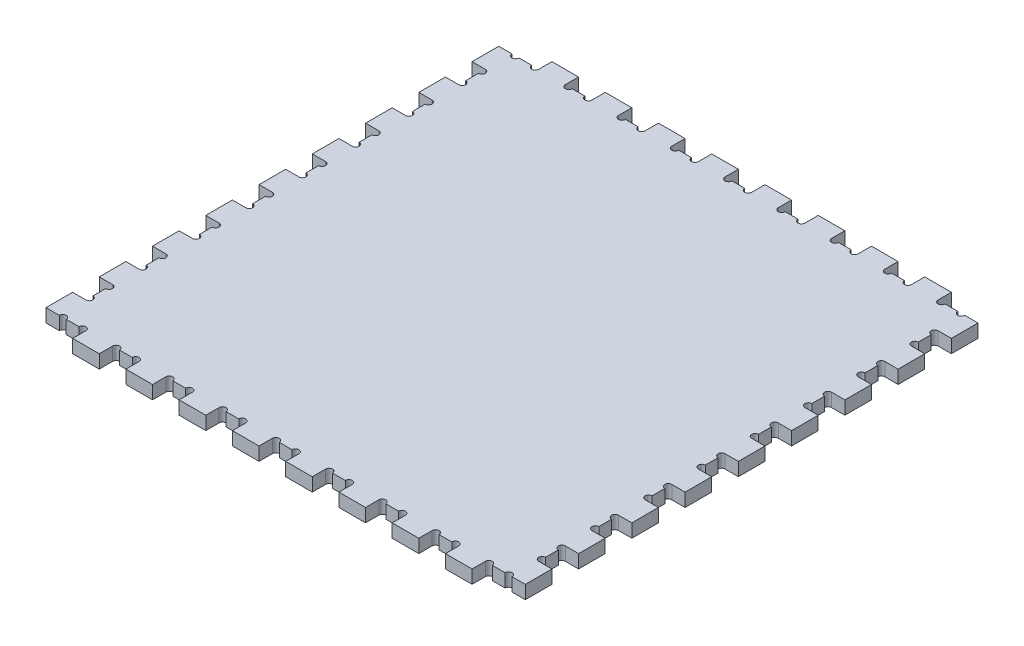
from build123d import *

# Parameters (mm, degrees)
SKETCH1_W               = 457.2
SKETCH1_H               = 457.2
BOSS_EXTRUDE1_DEPTH     = 12.7
CUT_EXTRUDE1_DEPTH      = 12.7
LPATTERN1_COUNT         = 9
LPATTERN1_PITCH         = 50.8
MIRROR1_COPY_1_DEPTH    = 12.7
MIRROR1_COPY_2_DEPTH    = 12.7
MIRROR1_COPY_3_DEPTH    = 12.7
MIRROR1_COPY_4_DEPTH    = 12.7
MIRROR1_COPY_5_DEPTH    = 12.7
MIRROR1_COPY_6_DEPTH    = 12.7
MIRROR1_COPY_7_DEPTH    = 12.7
MIRROR1_COPY_8_DEPTH    = 12.7
MIRROR1_COPY_9_DEPTH    = 12.7
SKETCH3_W               = 12.7
SKETCH3_H               = 12.7
CUT_EXTRUDE2_DEPTH      = 324.538575753
MIRROR3_COPY_1_SKETCH_W = 12.7
MIRROR3_COPY_1_SKETCH_H = 12.7
MIRROR3_COPY_1_DEPTH    = 324.538575753
MIRROR3_COPY_2_SKETCH_W = 12.7
MIRROR3_COPY_2_SKETCH_H = 12.7
MIRROR3_COPY_2_DEPTH    = 324.538575753
CUT_EXTRUDE3_DEPTH      = 324.538575753
LPATTERN2_COUNT         = 9
LPATTERN2_PITCH         = 50.8
MIRROR4_COPY_1_DEPTH    = 324.538575753
MIRROR4_COPY_2_DEPTH    = 324.538575753
MIRROR4_COPY_3_DEPTH    = 324.538575753
MIRROR4_COPY_4_DEPTH    = 324.538575753
MIRROR4_COPY_5_DEPTH    = 324.538575753
MIRROR4_COPY_6_DEPTH    = 324.538575753
MIRROR4_COPY_7_DEPTH    = 324.538575753
MIRROR4_COPY_8_DEPTH    = 324.538575753
MIRROR4_COPY_9_DEPTH    = 324.538575753


with BuildPart() as part:
    # Sketch1 → Boss-Extrude1 (new body)
    with BuildSketch(Plane(origin=(0, 0, 0), x_dir=(1, 0, 0), z_dir=(0, 1, 0))):
        Rectangle(SKETCH1_W, SKETCH1_H)
    extrude(amount=BOSS_EXTRUDE1_DEPTH)

    # Sketch2 → Cut-Extrude1 (cut)
    with BuildSketch(Plane(origin=(0, 12.7, 0), x_dir=(1, 0, 0), z_dir=(0, 1, 0))):
        with BuildLine():
            Line((-190.5, 228.6), (-215.9, 228.6))
            Line((-215.9, 228.6), (-215.9, 215.9))
            ThreePointArc((-215.9, 215.9), (-212.598, 212.598), (-209.296, 215.9))
            Line((-209.296, 215.9), (-197.104, 215.9))
            ThreePointArc((-197.104, 215.9), (-193.802, 212.598), (-190.5, 215.9))
            Line((-190.5, 215.9), (-190.5, 228.6))
        make_face()
    cut_extrude1 = extrude(amount=-CUT_EXTRUDE1_DEPTH, mode=Mode.SUBTRACT)

    # LPattern1: Cut-Extrude1 ×9
    with Locations(*[(i * LPATTERN1_PITCH, 0, 0) for i in range(1, LPATTERN1_COUNT)]):
        add(cut_extrude1, mode=Mode.SUBTRACT)

    # Mirror1 copy 1 sketch → Mirror1 copy 1 (cut)
    with BuildSketch(Plane(origin=(50.8, 12.7, 0), x_dir=(1, 0, 0), z_dir=(0, 1, 0))):
        with BuildLine():
            Line((-190.5, -228.6), (-215.9, -228.6))
            Line((-215.9, -228.6), (-215.9, -215.9))
            ThreePointArc((-215.9, -215.9), (-212.598, -212.598), (-209.296, -215.9))
            Line((-209.296, -215.9), (-197.104, -215.9))
            ThreePointArc((-197.104, -215.9), (-193.802, -212.598), (-190.5, -215.9))
            Line((-190.5, -215.9), (-190.5, -228.6))
        make_face()
    extrude(amount=-MIRROR1_COPY_1_DEPTH, mode=Mode.SUBTRACT)

    # Mirror1 copy 2 sketch → Mirror1 copy 2 (cut)
    with BuildSketch(Plane(origin=(101.6, 12.7, 0), x_dir=(1, 0, 0), z_dir=(0, 1, 0))):
        with BuildLine():
            Line((-190.5, -228.6), (-215.9, -228.6))
            Line((-215.9, -228.6), (-215.9, -215.9))
            ThreePointArc((-215.9, -215.9), (-212.598, -212.598), (-209.296, -215.9))
            Line((-209.296, -215.9), (-197.104, -215.9))
            ThreePointArc((-197.104, -215.9), (-193.802, -212.598), (-190.5, -215.9))
            Line((-190.5, -215.9), (-190.5, -228.6))
        make_face()
    extrude(amount=-MIRROR1_COPY_2_DEPTH, mode=Mode.SUBTRACT)

    # Mirror1 copy 3 sketch → Mirror1 copy 3 (cut)
    with BuildSketch(Plane(origin=(152.4, 12.7, 0), x_dir=(1, 0, 0), z_dir=(0, 1, 0))):
        with BuildLine():
            Line((-190.5, -228.6), (-215.9, -228.6))
            Line((-215.9, -228.6), (-215.9, -215.9))
            ThreePointArc((-215.9, -215.9), (-212.598, -212.598), (-209.296, -215.9))
            Line((-209.296, -215.9), (-197.104, -215.9))
            ThreePointArc((-197.104, -215.9), (-193.802, -212.598), (-190.5, -215.9))
            Line((-190.5, -215.9), (-190.5, -228.6))
        make_face()
    extrude(amount=-MIRROR1_COPY_3_DEPTH, mode=Mode.SUBTRACT)

    # Mirror1 copy 4 sketch → Mirror1 copy 4 (cut)
    with BuildSketch(Plane(origin=(203.2, 12.7, 0), x_dir=(1, 0, 0), z_dir=(0, 1, 0))):
        with BuildLine():
            Line((-190.5, -228.6), (-215.9, -228.6))
            Line((-215.9, -228.6), (-215.9, -215.9))
            ThreePointArc((-215.9, -215.9), (-212.598, -212.598), (-209.296, -215.9))
            Line((-209.296, -215.9), (-197.104, -215.9))
            ThreePointArc((-197.104, -215.9), (-193.802, -212.598), (-190.5, -215.9))
            Line((-190.5, -215.9), (-190.5, -228.6))
        make_face()
    extrude(amount=-MIRROR1_COPY_4_DEPTH, mode=Mode.SUBTRACT)

    # Mirror1 copy 5 sketch → Mirror1 copy 5 (cut)
    with BuildSketch(Plane(origin=(254, 12.7, 0), x_dir=(1, 0, 0), z_dir=(0, 1, 0))):
        with BuildLine():
            Line((-190.5, -228.6), (-215.9, -228.6))
            Line((-215.9, -228.6), (-215.9, -215.9))
            ThreePointArc((-215.9, -215.9), (-212.598, -212.598), (-209.296, -215.9))
            Line((-209.296, -215.9), (-197.104, -215.9))
            ThreePointArc((-197.104, -215.9), (-193.802, -212.598), (-190.5, -215.9))
            Line((-190.5, -215.9), (-190.5, -228.6))
        make_face()
    extrude(amount=-MIRROR1_COPY_5_DEPTH, mode=Mode.SUBTRACT)

    # Mirror1 copy 6 sketch → Mirror1 copy 6 (cut)
    with BuildSketch(Plane(origin=(304.8, 12.7, 0), x_dir=(1, 0, 0), z_dir=(0, 1, 0))):
        with BuildLine():
            Line((-190.5, -228.6), (-215.9, -228.6))
            Line((-215.9, -228.6), (-215.9, -215.9))
            ThreePointArc((-215.9, -215.9), (-212.598, -212.598), (-209.296, -215.9))
            Line((-209.296, -215.9), (-197.104, -215.9))
            ThreePointArc((-197.104, -215.9), (-193.802, -212.598), (-190.5, -215.9))
            Line((-190.5, -215.9), (-190.5, -228.6))
        make_face()
    extrude(amount=-MIRROR1_COPY_6_DEPTH, mode=Mode.SUBTRACT)

    # Mirror1 copy 7 sketch → Mirror1 copy 7 (cut)
    with BuildSketch(Plane(origin=(355.6, 12.7, 0), x_dir=(1, 0, 0), z_dir=(0, 1, 0))):
        with BuildLine():
            Line((-190.5, -228.6), (-215.9, -228.6))
            Line((-215.9, -228.6), (-215.9, -215.9))
            ThreePointArc((-215.9, -215.9), (-212.598, -212.598), (-209.296, -215.9))
            Line((-209.296, -215.9), (-197.104, -215.9))
            ThreePointArc((-197.104, -215.9), (-193.802, -212.598), (-190.5, -215.9))
            Line((-190.5, -215.9), (-190.5, -228.6))
        make_face()
    extrude(amount=-MIRROR1_COPY_7_DEPTH, mode=Mode.SUBTRACT)

    # Mirror1 copy 8 sketch → Mirror1 copy 8 (cut)
    with BuildSketch(Plane(origin=(406.4, 12.7, 0), x_dir=(1, 0, 0), z_dir=(0, 1, 0))):
        with BuildLine():
            Line((-190.5, -228.6), (-215.9, -228.6))
            Line((-215.9, -228.6), (-215.9, -215.9))
            ThreePointArc((-215.9, -215.9), (-212.598, -212.598), (-209.296, -215.9))
            Line((-209.296, -215.9), (-197.104, -215.9))
            ThreePointArc((-197.104, -215.9), (-193.802, -212.598), (-190.5, -215.9))
            Line((-190.5, -215.9), (-190.5, -228.6))
        make_face()
    extrude(amount=-MIRROR1_COPY_8_DEPTH, mode=Mode.SUBTRACT)

    # Mirror1 copy 9 sketch → Mirror1 copy 9 (cut)
    with BuildSketch(Plane(origin=(0, 12.7, 0), x_dir=(1, 0, 0), z_dir=(0, 1, 0))):
        with BuildLine():
            Line((-190.5, -228.6), (-215.9, -228.6))
            Line((-215.9, -228.6), (-215.9, -215.9))
            ThreePointArc((-215.9, -215.9), (-212.598, -212.598), (-209.296, -215.9))
            Line((-209.296, -215.9), (-197.104, -215.9))
            ThreePointArc((-197.104, -215.9), (-193.802, -212.598), (-190.5, -215.9))
            Line((-190.5, -215.9), (-190.5, -228.6))
        make_face()
    extrude(amount=-MIRROR1_COPY_9_DEPTH, mode=Mode.SUBTRACT)

    # Sketch3 → Cut-Extrude2 (cut, through all)
    with BuildSketch(Plane(origin=(0, 12.7, 0), x_dir=(1, 0, 0), z_dir=(0, 1, 0))):
        with Locations((-222.25, 222.25)):
            Rectangle(SKETCH3_W, SKETCH3_H)
    cut_extrude2 = extrude(amount=-CUT_EXTRUDE2_DEPTH, mode=Mode.SUBTRACT)

    # Mirror2: Cut-Extrude2 across plane
    add(cut_extrude2.mirror(Plane.ZY), mode=Mode.SUBTRACT)

    # Mirror3 copy 1 sketch → Mirror3 copy 1 (cut, through all)
    with BuildSketch(Plane(origin=(0, 12.7, 0), x_dir=(-1, 0, 0), z_dir=(0, 1, 0))):
        with Locations((-222.25, 222.25)):
            Rectangle(MIRROR3_COPY_1_SKETCH_W, MIRROR3_COPY_1_SKETCH_H)
    extrude(amount=-MIRROR3_COPY_1_DEPTH, mode=Mode.SUBTRACT)

    # Mirror3 copy 2 sketch → Mirror3 copy 2 (cut, through all)
    with BuildSketch(Plane(origin=(0, 12.7, 0), x_dir=(1, 0, 0), z_dir=(0, 1, 0))):
        with Locations((-222.25, -222.25)):
            Rectangle(MIRROR3_COPY_2_SKETCH_W, MIRROR3_COPY_2_SKETCH_H)
    extrude(amount=-MIRROR3_COPY_2_DEPTH, mode=Mode.SUBTRACT)

    # Sketch4 → Cut-Extrude3 (cut, through all)
    with BuildSketch(Plane(origin=(0, 12.7, 0), x_dir=(1, 0, 0), z_dir=(0, 1, 0))):
        with BuildLine():
            Line((-215.9, 190.5), (-228.6, 190.5))
            Line((-228.6, 190.5), (-228.6, 165.1))
            Line((-228.6, 165.1), (-215.9, 165.1))
            ThreePointArc((-215.9, 165.1), (-212.598, 168.402), (-215.9, 171.704))
            Line((-215.9, 171.704), (-215.9, 183.896))
            ThreePointArc((-215.9, 183.896), (-212.598, 187.198), (-215.9, 190.5))
        make_face()
    cut_extrude3 = extrude(amount=-CUT_EXTRUDE3_DEPTH, mode=Mode.SUBTRACT)

    # LPattern2: Cut-Extrude3 ×9
    with Locations(*[(0, 0, i * LPATTERN2_PITCH) for i in range(1, LPATTERN2_COUNT)]):
        add(cut_extrude3, mode=Mode.SUBTRACT)

    # Mirror4 copy 1 sketch → Mirror4 copy 1 (cut, through all)
    with BuildSketch(Plane(origin=(0, 12.7, 50.8), x_dir=(-1, 0, 0), z_dir=(0, 1, 0))):
        with BuildLine():
            Line((-215.9, -190.5), (-228.6, -190.5))
            Line((-228.6, -190.5), (-228.6, -165.1))
            Line((-228.6, -165.1), (-215.9, -165.1))
            ThreePointArc((-215.9, -165.1), (-212.598, -168.402), (-215.9, -171.704))
            Line((-215.9, -171.704), (-215.9, -183.896))
            ThreePointArc((-215.9, -183.896), (-212.598, -187.198), (-215.9, -190.5))
        make_face()
    extrude(amount=-MIRROR4_COPY_1_DEPTH, mode=Mode.SUBTRACT)

    # Mirror4 copy 2 sketch → Mirror4 copy 2 (cut, through all)
    with BuildSketch(Plane(origin=(0, 12.7, 101.6), x_dir=(-1, 0, 0), z_dir=(0, 1, 0))):
        with BuildLine():
            Line((-215.9, -190.5), (-228.6, -190.5))
            Line((-228.6, -190.5), (-228.6, -165.1))
            Line((-228.6, -165.1), (-215.9, -165.1))
            ThreePointArc((-215.9, -165.1), (-212.598, -168.402), (-215.9, -171.704))
            Line((-215.9, -171.704), (-215.9, -183.896))
            ThreePointArc((-215.9, -183.896), (-212.598, -187.198), (-215.9, -190.5))
        make_face()
    extrude(amount=-MIRROR4_COPY_2_DEPTH, mode=Mode.SUBTRACT)

    # Mirror4 copy 3 sketch → Mirror4 copy 3 (cut, through all)
    with BuildSketch(Plane(origin=(0, 12.7, 152.4), x_dir=(-1, 0, 0), z_dir=(0, 1, 0))):
        with BuildLine():
            Line((-215.9, -190.5), (-228.6, -190.5))
            Line((-228.6, -190.5), (-228.6, -165.1))
            Line((-228.6, -165.1), (-215.9, -165.1))
            ThreePointArc((-215.9, -165.1), (-212.598, -168.402), (-215.9, -171.704))
            Line((-215.9, -171.704), (-215.9, -183.896))
            ThreePointArc((-215.9, -183.896), (-212.598, -187.198), (-215.9, -190.5))
        make_face()
    extrude(amount=-MIRROR4_COPY_3_DEPTH, mode=Mode.SUBTRACT)

    # Mirror4 copy 4 sketch → Mirror4 copy 4 (cut, through all)
    with BuildSketch(Plane(origin=(0, 12.7, 203.2), x_dir=(-1, 0, 0), z_dir=(0, 1, 0))):
        with BuildLine():
            Line((-215.9, -190.5), (-228.6, -190.5))
            Line((-228.6, -190.5), (-228.6, -165.1))
            Line((-228.6, -165.1), (-215.9, -165.1))
            ThreePointArc((-215.9, -165.1), (-212.598, -168.402), (-215.9, -171.704))
            Line((-215.9, -171.704), (-215.9, -183.896))
            ThreePointArc((-215.9, -183.896), (-212.598, -187.198), (-215.9, -190.5))
        make_face()
    extrude(amount=-MIRROR4_COPY_4_DEPTH, mode=Mode.SUBTRACT)

    # Mirror4 copy 5 sketch → Mirror4 copy 5 (cut, through all)
    with BuildSketch(Plane(origin=(0, 12.7, 254), x_dir=(-1, 0, 0), z_dir=(0, 1, 0))):
        with BuildLine():
            Line((-215.9, -190.5), (-228.6, -190.5))
            Line((-228.6, -190.5), (-228.6, -165.1))
            Line((-228.6, -165.1), (-215.9, -165.1))
            ThreePointArc((-215.9, -165.1), (-212.598, -168.402), (-215.9, -171.704))
            Line((-215.9, -171.704), (-215.9, -183.896))
            ThreePointArc((-215.9, -183.896), (-212.598, -187.198), (-215.9, -190.5))
        make_face()
    extrude(amount=-MIRROR4_COPY_5_DEPTH, mode=Mode.SUBTRACT)

    # Mirror4 copy 6 sketch → Mirror4 copy 6 (cut, through all)
    with BuildSketch(Plane(origin=(0, 12.7, 304.8), x_dir=(-1, 0, 0), z_dir=(0, 1, 0))):
        with BuildLine():
            Line((-215.9, -190.5), (-228.6, -190.5))
            Line((-228.6, -190.5), (-228.6, -165.1))
            Line((-228.6, -165.1), (-215.9, -165.1))
            ThreePointArc((-215.9, -165.1), (-212.598, -168.402), (-215.9, -171.704))
            Line((-215.9, -171.704), (-215.9, -183.896))
            ThreePointArc((-215.9, -183.896), (-212.598, -187.198), (-215.9, -190.5))
        make_face()
    extrude(amount=-MIRROR4_COPY_6_DEPTH, mode=Mode.SUBTRACT)

    # Mirror4 copy 7 sketch → Mirror4 copy 7 (cut, through all)
    with BuildSketch(Plane(origin=(0, 12.7, 355.6), x_dir=(-1, 0, 0), z_dir=(0, 1, 0))):
        with BuildLine():
            Line((-215.9, -190.5), (-228.6, -190.5))
            Line((-228.6, -190.5), (-228.6, -165.1))
            Line((-228.6, -165.1), (-215.9, -165.1))
            ThreePointArc((-215.9, -165.1), (-212.598, -168.402), (-215.9, -171.704))
            Line((-215.9, -171.704), (-215.9, -183.896))
            ThreePointArc((-215.9, -183.896), (-212.598, -187.198), (-215.9, -190.5))
        make_face()
    extrude(amount=-MIRROR4_COPY_7_DEPTH, mode=Mode.SUBTRACT)

    # Mirror4 copy 8 sketch → Mirror4 copy 8 (cut, through all)
    with BuildSketch(Plane(origin=(0, 12.7, 406.4), x_dir=(-1, 0, 0), z_dir=(0, 1, 0))):
        with BuildLine():
            Line((-215.9, -190.5), (-228.6, -190.5))
            Line((-228.6, -190.5), (-228.6, -165.1))
            Line((-228.6, -165.1), (-215.9, -165.1))
            ThreePointArc((-215.9, -165.1), (-212.598, -168.402), (-215.9, -171.704))
            Line((-215.9, -171.704), (-215.9, -183.896))
            ThreePointArc((-215.9, -183.896), (-212.598, -187.198), (-215.9, -190.5))
        make_face()
    extrude(amount=-MIRROR4_COPY_8_DEPTH, mode=Mode.SUBTRACT)

    # Mirror4 copy 9 sketch → Mirror4 copy 9 (cut, through all)
    with BuildSketch(Plane(origin=(0, 12.7, 0), x_dir=(-1, 0, 0), z_dir=(0, 1, 0))):
        with BuildLine():
            Line((-215.9, -190.5), (-228.6, -190.5))
            Line((-228.6, -190.5), (-228.6, -165.1))
            Line((-228.6, -165.1), (-215.9, -165.1))
            ThreePointArc((-215.9, -165.1), (-212.598, -168.402), (-215.9, -171.704))
            Line((-215.9, -171.704), (-215.9, -183.896))
            ThreePointArc((-215.9, -183.896), (-212.598, -187.198), (-215.9, -190.5))
        make_face()
    extrude(amount=-MIRROR4_COPY_9_DEPTH, mode=Mode.SUBTRACT)


solid = part.part
